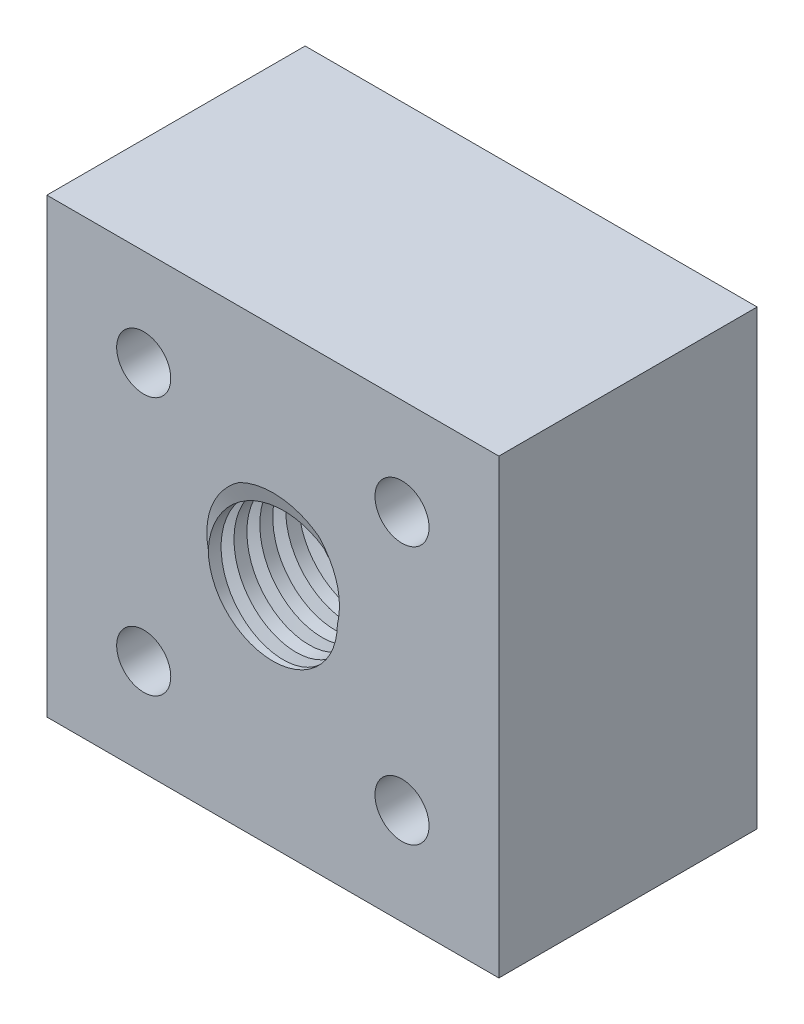
from build123d import *

# Parameters (mm, degrees)
SKETCH1_W           = 35
SKETCH1_H           = 35
SKETCH1_R           = 2.094197499
SKETCH1_R_2         = 5
BOSS_EXTRUDE1_DEPTH = 20
CUT_SWEEP1_PITCH    = 2


with BuildPart() as part:
    # Sketch1 → Boss-Extrude1 (new body)
    with BuildSketch(Plane.XY):
        Rectangle(SKETCH1_W, SKETCH1_H)
        with Locations((-10, 10)):
            Circle(SKETCH1_R, mode=Mode.SUBTRACT)
        with Locations((10, 10)):
            Circle(SKETCH1_R, mode=Mode.SUBTRACT)
        with Locations((10, -10)):
            Circle(SKETCH1_R, mode=Mode.SUBTRACT)
        with Locations((-10, -10)):
            Circle(SKETCH1_R, mode=Mode.SUBTRACT)
        Circle(SKETCH1_R_2, mode=Mode.SUBTRACT)
    extrude(amount=BOSS_EXTRUDE1_DEPTH)

    # Cut-Sweep1: arcs per turn and ends read off the stored shape
    # Cut-Sweep1: the profile of Sketch4 profile screwed along a right-hand helix through 10.75 turns, 10 arcs to a turn; built about Z, then put on its axis
    cut_sweep1_z = Axis((0, 0, 0), (0, 0, 1))
    cut_sweep1_corners = [(4.9997, 0, -2.000073687), (4.9997, 0, -0.999912842), (6.25, 0, -1.363158571), (6.25, 0, -1.692970552)]
    with BuildLine(mode=Mode.PRIVATE) as cut_sweep1_profile:
        Line(cut_sweep1_corners[0], cut_sweep1_corners[1])
        Line(cut_sweep1_corners[1], cut_sweep1_corners[2])
        Line(cut_sweep1_corners[3], cut_sweep1_corners[0])
        ThreePointArc((6.25, 0, -1.363158571), (6.299388719, 0, -1.528064561), (6.25, 0, -1.692970552))
    cut_sweep1_cap = Face(cut_sweep1_profile.wire())
    cut_sweep1_arcs = [((6.25, 0, -1.363158571), (6.358510621, 0, -1.528064561), (6.25, 0, -1.692970552), (1, 0.8353709375450658, 1))]  # start, shoulder, end, weights
    cut_sweep1_turn_angles = [0, 18, 36, 54, 72, 90, 108, 126, 144, 162, 180, 198, 216, 234, 252, 270, 288, 306, 324, 342, 360]
    cut_sweep1_turn_weights = [1, 0.9510565162951535, 1, 0.9510565162951535, 1, 0.9510565162951535, 1, 0.9510565162951535, 1, 0.9510565162951535, 1, 0.9510565162951535, 1, 0.9510565162951535, 1, 0.9510565162951535, 1, 0.9510565162951535, 1, 0.9510565162951535, 1]
    cut_sweep1_turn_rails = [Edge.make_bspline([Vector(p[0], p[1], 0).rotate(cut_sweep1_z, cut_sweep1_turn_angles[k]) / cut_sweep1_turn_weights[k] + Vector(0, 0, p[2] + CUT_SWEEP1_PITCH * cut_sweep1_turn_angles[k] / 360) for k in range(21)], [0, 0, 0, 1, 1, 2, 2, 3, 3, 4, 4, 5, 5, 6, 6, 7, 7, 8, 8, 9, 9, 10, 10, 10], 2, cut_sweep1_turn_weights) for p in cut_sweep1_corners]
    cut_sweep1_turn_sides = [*[Face.make_surface_from_curves(cut_sweep1_turn_rails[p[0]], cut_sweep1_turn_rails[p[1]]) for p in [(0, 1), (1, 2), (3, 0)]], *[Face.make_bezier_surface([[Vector(p[j][0], p[j][1], 0).rotate(cut_sweep1_z, cut_sweep1_turn_angles[2 * i + k]) / cut_sweep1_turn_weights[2 * i + k] + Vector(0, 0, p[j][2] + CUT_SWEEP1_PITCH * cut_sweep1_turn_angles[2 * i + k] / 360) for k in range(3)] for j in range(3)], [[p[3][j] * cut_sweep1_turn_weights[2 * i + k] for k in range(3)] for j in range(3)]) for p in cut_sweep1_arcs for i in range(10)]]
    cut_sweep1_last_angles = [3600, 3618, 3636, 3654, 3672, 3690, 3708, 3726, 3744, 3762, 3780, 3798, 3816, 3834, 3852, 3861, 3870]
    cut_sweep1_last_weights = [1, 0.9510565162951535, 1, 0.9510565162951535, 1, 0.9510565162951535, 1, 0.9510565162951535, 1, 0.9510565162951535, 1, 0.9510565162951535, 1, 0.9510565162951535, 1, 0.9876883405951452, 1]
    cut_sweep1_last_rails = [Edge.make_bspline([Vector(p[0], p[1], 0).rotate(cut_sweep1_z, cut_sweep1_last_angles[k]) / cut_sweep1_last_weights[k] + Vector(0, 0, p[2] + CUT_SWEEP1_PITCH * cut_sweep1_last_angles[k] / 360) for k in range(17)], [0, 0, 0, 1, 1, 2, 2, 3, 3, 4, 4, 5, 5, 6, 6, 7, 7, 8, 8, 8], 2, cut_sweep1_last_weights) for p in cut_sweep1_corners]
    cut_sweep1_last_sides = [*[Face.make_surface_from_curves(cut_sweep1_last_rails[p[0]], cut_sweep1_last_rails[p[1]]) for p in [(0, 1), (1, 2), (3, 0)]], *[Face.make_bezier_surface([[Vector(p[j][0], p[j][1], 0).rotate(cut_sweep1_z, cut_sweep1_last_angles[2 * i + k]) / cut_sweep1_last_weights[2 * i + k] + Vector(0, 0, p[j][2] + CUT_SWEEP1_PITCH * cut_sweep1_last_angles[2 * i + k] / 360) for k in range(3)] for j in range(3)], [[p[3][j] * cut_sweep1_last_weights[2 * i + k] for k in range(3)] for j in range(3)]) for p in cut_sweep1_arcs for i in range(8)]]
    cut_sweep1 = Plane(origin=(0, 0, 20), x_dir=(1, 0, 0), z_dir=(0, 0, -1)) * Solid(Shell([*[p.moved(Location((0, 0, CUT_SWEEP1_PITCH * i))) for i in range(10) for p in cut_sweep1_turn_sides], *cut_sweep1_last_sides, cut_sweep1_cap, cut_sweep1_cap.rotate(cut_sweep1_z, 3870).moved(Location((0, 0, CUT_SWEEP1_PITCH * 3870 / 360)))]))
    add(cut_sweep1, mode=Mode.SUBTRACT)


solid = part.part
